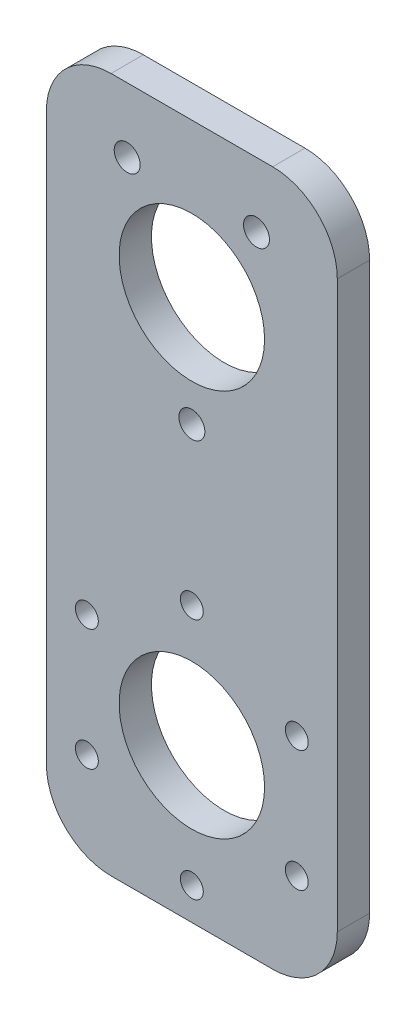
from build123d import *

# Parameters (mm, degrees)
SKETCH1_W              = 57.15
SKETCH1_H              = 136.525
SKETCH1_R              = 14.2875
BOSS_EXTRUDE1_DEPTH    = 3.175
FILLET1_R              = 12.7
F_8_CLEARANCE_HOLE1_D  = 4.4958
F_10_CLEARANCE_HOLE1_D = 5.1054


with BuildPart() as part:
    # Sketch1 → Boss-Extrude1 (new, symmetric)
    with BuildSketch(Plane.XY):
        Rectangle(SKETCH1_W, SKETCH1_H)
        with Locations((0, 38.1)):
            Circle(SKETCH1_R, mode=Mode.SUBTRACT)
        with Locations((0, -38.1)):
            Circle(SKETCH1_R, mode=Mode.SUBTRACT)
    extrude(amount=BOSS_EXTRUDE1_DEPTH, both=True)

    # Fillet1
    fillet1_edges = [part.edges().sort_by_distance(p)[0] for p in [
        (28.575, -68.2625, 0),
        (-28.575, -68.2625, 0),
        (-28.575, 68.2625, 0),
        (28.575, 68.2625, 0),
    ]]
    fillet(fillet1_edges, radius=FILLET1_R)

    # #8 Clearance Hole1 (through all)
    with Locations(Plane.XY.offset(3.175)):
        with Locations((0, -14.2875), (20.622229928, -26.19375), (20.622229928, -50.00625), (0, -61.9125), (-20.622229928, -50.00625), (-20.622229928, -26.19375), (0, -38.1)):
            Hole(F_8_CLEARANCE_HOLE1_D / 2)

    # #10 Clearance Hole1 (through all)
    with Locations(Plane.XY.offset(3.175)):
        with Locations((-12.7, 55.5625), (12.7, 55.5625), (0, 16.51)):
            Hole(F_10_CLEARANCE_HOLE1_D / 2)


solid = part.part
